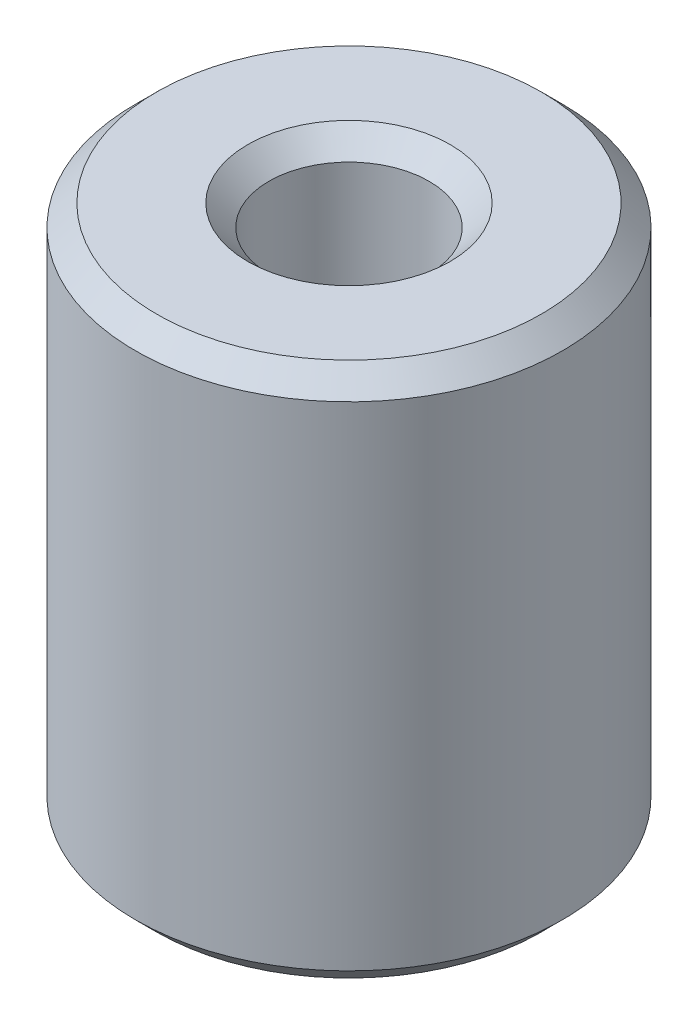
from build123d import *

# Parameters (mm, degrees)
SKETCH1_R           = 17.5
BOSS_EXTRUDE1_DEPTH = 43.848574182
SKETCH2_R           = 6.564013099
CUT_EXTRUDE1_DEPTH  = 51.350744362
CHAMFER1_SIZE       = 1.734317894


with BuildPart() as part:
    # Sketch1 → Boss-Extrude1 (new body)
    with BuildSketch(Plane(origin=(0, 0, 0), x_dir=(1, 0, 0), z_dir=(0, 1, 0))):
        Circle(SKETCH1_R)
    extrude(amount=BOSS_EXTRUDE1_DEPTH)

    # Sketch2 → Cut-Extrude1 (cut, through all)
    with BuildSketch(Plane(origin=(0, 0, 0), x_dir=(1, 0, 0), z_dir=(0, 1, 0))):
        Circle(SKETCH2_R)
    extrude(amount=CUT_EXTRUDE1_DEPTH, mode=Mode.SUBTRACT)

    # Chamfer1
    chamfer1_edges = [part.edges().sort_by_distance(p)[0] for p in [
        (-6.564013099, 43.848574182, 0),
        (-6.564013099, 0, 0),
        (-17.5, 0, 0),
        (-17.5, 43.848574182, 0),
    ]]
    chamfer(chamfer1_edges, length=CHAMFER1_SIZE)


solid = part.part
